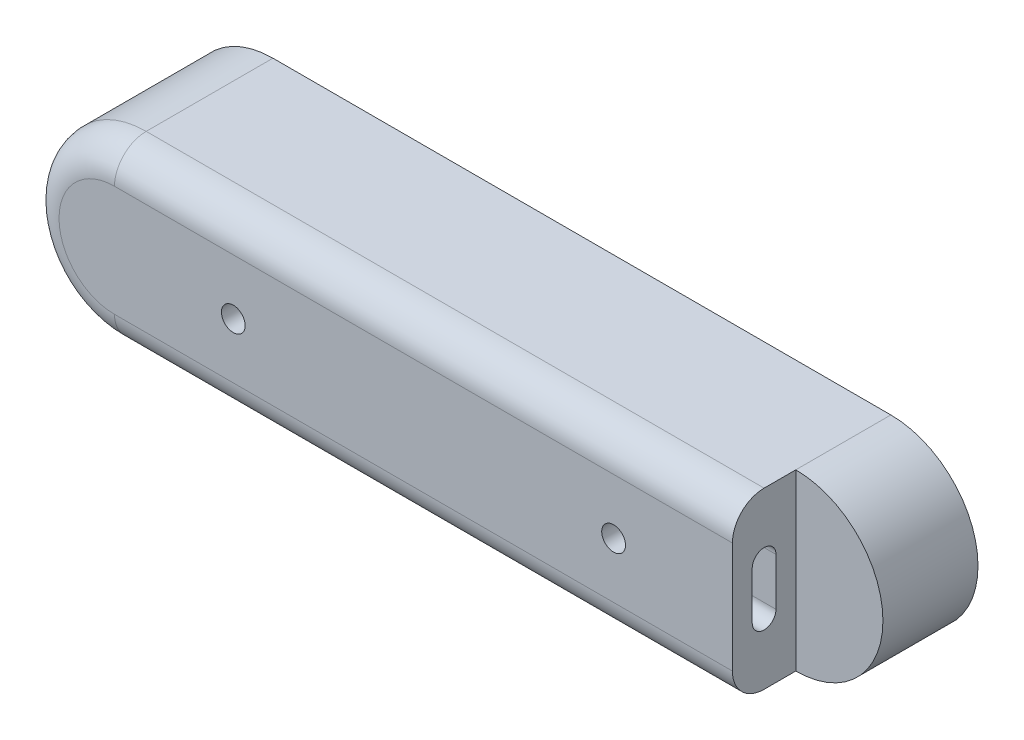
from build123d import *

# Parameters (mm, degrees)
SKETCH_1_W          = 100.00000000000001
SKETCH_1_H          = 22
EXTRUDE_3_DEPTH     = 20
CUT_EXTRUDE_2_DEPTH = 20
CUT_EXTRUDE_3_DEPTH = 8
SKETCH_5_W          = 3.0000000000000018
SKETCH_5_H          = 9
CUT_EXTRUDE_5_DEPTH = 7
EXTRUDE_4_DEPTH     = 7
SKETCH_8_R          = 6
CUT_EXTRUDE_7_DEPTH = 10
FILLET_1_R          = 4
SKETCH_9_R          = 1.5000000000000007
CUT_EXTRUDE_8_DEPTH = 5
SKETCH_10_R         = 6.000000000004547
EXTRUDE_5_DEPTH     = 10
SKETCH_11_R         = 4
CUT_EXTRUDE_9_DEPTH = 10


with BuildPart() as part:
    # 草图1 → 凸台-拉伸3 (new body)
    with BuildSketch(Plane.XY):
        Rectangle(SKETCH_1_W, SKETCH_1_H)
    extrude(amount=EXTRUDE_3_DEPTH)

    # 草图3 → 切除-拉伸2 (cut)
    with BuildSketch(Plane.XY.offset(20)):
        with BuildLine():
            ThreePointArc((-50.00000000000001, 9.1e-16), (-46.77817459305203, 7.778174593052023), (-39.00000000000001, 11))
            Line((-39, 11), (-50, 11))
            Line((-50, 11), (-50, 1.78e-15))
        make_face()
        with BuildLine():
            Line((50, 11), (39.00000000000001, 11))
            ThreePointArc((39.00000000000001, 11), (46.77817459305203, 7.778174593052022), (50.00000000000001, -4.3e-16))
            Line((50, 0), (50, 11))
        make_face()
        with BuildLine():
            ThreePointArc((-39.00000000000001, -11), (-46.77817459305203, -7.778174593052022), (-50.00000000000001, 9.1e-16))
            Line((-50, 1.78e-15), (-50, -11))
            Line((-50, -11), (-39.00000000000001, -11))
        make_face()
        with BuildLine():
            Line((50, -11), (50, 0))
            ThreePointArc((50.00000000000001, -3.13e-15), (46.77817459305203, -7.778174593052024), (39.00000000000001, -11))
            Line((39, -11), (50, -11))
        make_face()
    extrude(amount=-CUT_EXTRUDE_2_DEPTH, mode=Mode.SUBTRACT)

    # 草图4 → 切除-拉伸3 (cut)
    with BuildSketch(Plane.XY.offset(20)):
        with BuildLine():
            ThreePointArc((50.000000000000014, 0), (46.77817459305202, 7.778174593052019), (38.999999999999986, 10.999999999999963))
            Line((38.999999999999964, 11), (39.00000000000013, -11))
            ThreePointArc((39.000000000000064, -10.999999999999963), (46.77817459305205, -7.7781745930519905), (50.000000000000014, -2.69e-15))
        make_face()
    extrude(amount=-CUT_EXTRUDE_3_DEPTH, mode=Mode.SUBTRACT)

    # 草图5 → 切除-拉伸5 (cut)
    with BuildSketch(Plane(origin=(39.00000000000005, 2.8292e-13, 0), x_dir=(0, 0, -1), z_dir=(1, 7.25e-15, 0))):
        with Locations((-16, 0)):
            Rectangle(SKETCH_5_W, SKETCH_5_H)
    extrude(amount=-CUT_EXTRUDE_5_DEPTH, mode=Mode.SUBTRACT)

    # 草图7 → 凸台-拉伸4 (add)
    with BuildSketch(Plane(origin=(32.00000000000005, 2.4672e-13, 0), x_dir=(0, 0, -1), z_dir=(1, 7.71e-15, 0))):
        with BuildLine():
            ThreePointArc((-17.5, 2.9999999999999836), (-17.060660171779823, 4.060660171779805), (-16, 4.499999999999984))
            Line((-16, 4.499999999999984), (-17.5, 4.499999999999985))
            Line((-17.5, 4.499999999999985), (-17.5, 2.9999999999999836))
        make_face()
        with BuildLine():
            Line((-14.499999999999998, 4.499999999999985), (-16, 4.499999999999984))
            ThreePointArc((-16, 4.499999999999984), (-14.939339828220177, 4.060660171779805), (-14.5, 2.9999999999999836))
            Line((-14.499999999999998, 2.9999999999999836), (-14.499999999999998, 4.499999999999985))
        make_face()
        with BuildLine():
            Line((-14.499999999999998, -4.500000000000014), (-14.499999999999998, -3.00000000000002))
            ThreePointArc((-14.5, -3.0000000000000204), (-14.939339828220177, -4.0606601717798405), (-15.999999999999998, -4.50000000000002))
            Line((-15.999999999999998, -4.500000000000016), (-14.499999999999998, -4.500000000000014))
        make_face()
        with BuildLine():
            ThreePointArc((-15.999999999999998, -4.50000000000002), (-17.060660171779823, -4.060660171779842), (-17.5, -3.00000000000002))
            Line((-17.5, -3.00000000000002), (-17.5, -4.500000000000018))
            Line((-17.5, -4.500000000000018), (-15.999999999999998, -4.500000000000016))
        make_face()
    extrude(amount=EXTRUDE_4_DEPTH)

    # 草图8 → 切除-拉伸7 (cut)
    with BuildSketch(Plane.XZ.offset(11)):
        with Locations((0, 9.999999999995454)):
            Circle(SKETCH_8_R)
    extrude(amount=-CUT_EXTRUDE_7_DEPTH, mode=Mode.SUBTRACT)

    # 圆角1
    fillet_1_edges = [part.edges().sort_by_distance(p)[0] for p in [
        (-50.00000000000001, -6.6e-16, 20),
        (0, -11, 20),
        (0, 11, 20),
    ]]
    fillet(fillet_1_edges, radius=FILLET_1_R)

    # 草图9 → 切除-拉伸8 (cut)
    with BuildSketch(Plane.XY.offset(20)):
        with Locations((-24.000000000000007, 0)):
            Circle(SKETCH_9_R)
        with Locations((24.000000000000007, 0)):
            Circle(SKETCH_9_R)
    extrude(amount=-CUT_EXTRUDE_8_DEPTH, mode=Mode.SUBTRACT)

    # 草图10 → 凸台-拉伸5 (add)
    with BuildSketch(Plane.XZ.offset(11)):
        with Locations((0, 9.999999999995454)):
            Circle(SKETCH_10_R)
    extrude(amount=-EXTRUDE_5_DEPTH)

    # 草图11 → 切除-拉伸9 (cut)
    with BuildSketch(Plane.XZ.offset(11)):
        with Locations((0, 8.000000000004889)):
            Circle(SKETCH_11_R)
    extrude(amount=-CUT_EXTRUDE_9_DEPTH, mode=Mode.SUBTRACT)


solid = part.part
